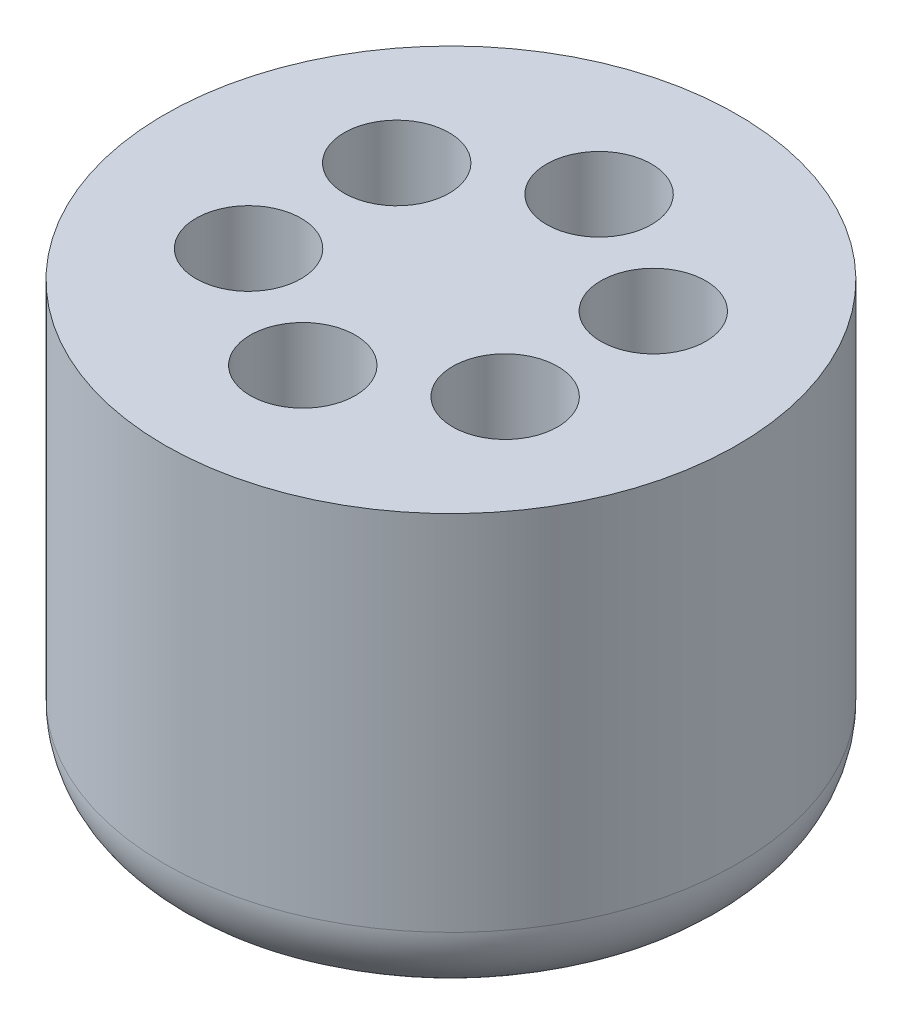
from build123d import *

# Parameters (mm, degrees)
SKETCH1_R           = 30
BOSS_EXTRUDE1_DEPTH = 46
SKETCH2_R           = 5.5
CUT_EXTRUDE1_DEPTH  = 32
FILLET1_R           = 8
SKETCH2_3_R         = 5.5
CUT_EXTRUDE2_DEPTH  = 35


with BuildPart() as part:
    # Sketch1 → Boss-Extrude1 (new body)
    with BuildSketch(Plane(origin=(0, 0, 0), x_dir=(1, 0, 0), z_dir=(0, 1, 0))):
        Circle(SKETCH1_R)
    extrude(amount=BOSS_EXTRUDE1_DEPTH)

    # Sketch2 → Cut-Extrude1 (cut)
    with BuildSketch(Plane(origin=(0, 46, 0), x_dir=(1, 0, 0), z_dir=(0, 1, 0))):
        with Locations((0, 15.52)):
            Circle(SKETCH2_R)
        with Locations((-13.440714267, 7.76)):
            Circle(SKETCH2_R)
        with Locations((-13.440714267, -7.76)):
            Circle(SKETCH2_R)
        with Locations((0, -15.52)):
            Circle(SKETCH2_R)
        with Locations((13.440714267, -7.76)):
            Circle(SKETCH2_R)
        with Locations((13.440714267, 7.76)):
            Circle(SKETCH2_R)
    extrude(amount=-CUT_EXTRUDE1_DEPTH, mode=Mode.SUBTRACT)

    # Fillet1
    fillet1_edges = [part.edges().sort_by_distance(p)[0] for p in [
        (-30, 0, 0),
    ]]
    fillet(fillet1_edges, radius=FILLET1_R)

    # Sketch2<3> → Cut-Extrude2 (cut)
    with BuildSketch(Plane(origin=(0, 46, 0), x_dir=(1, 0, 0), z_dir=(0, 1, 0))):
        with Locations((0, 15.52)):
            Circle(SKETCH2_3_R)
        with Locations((-13.440714267, 7.76)):
            Circle(SKETCH2_3_R)
        with Locations((-13.440714267, -7.76)):
            Circle(SKETCH2_3_R)
        with Locations((0, -15.52)):
            Circle(SKETCH2_3_R)
        with Locations((13.440714267, -7.76)):
            Circle(SKETCH2_3_R)
        with Locations((13.440714267, 7.76)):
            Circle(SKETCH2_3_R)
    extrude(amount=-CUT_EXTRUDE2_DEPTH, mode=Mode.SUBTRACT)


solid = part.part
